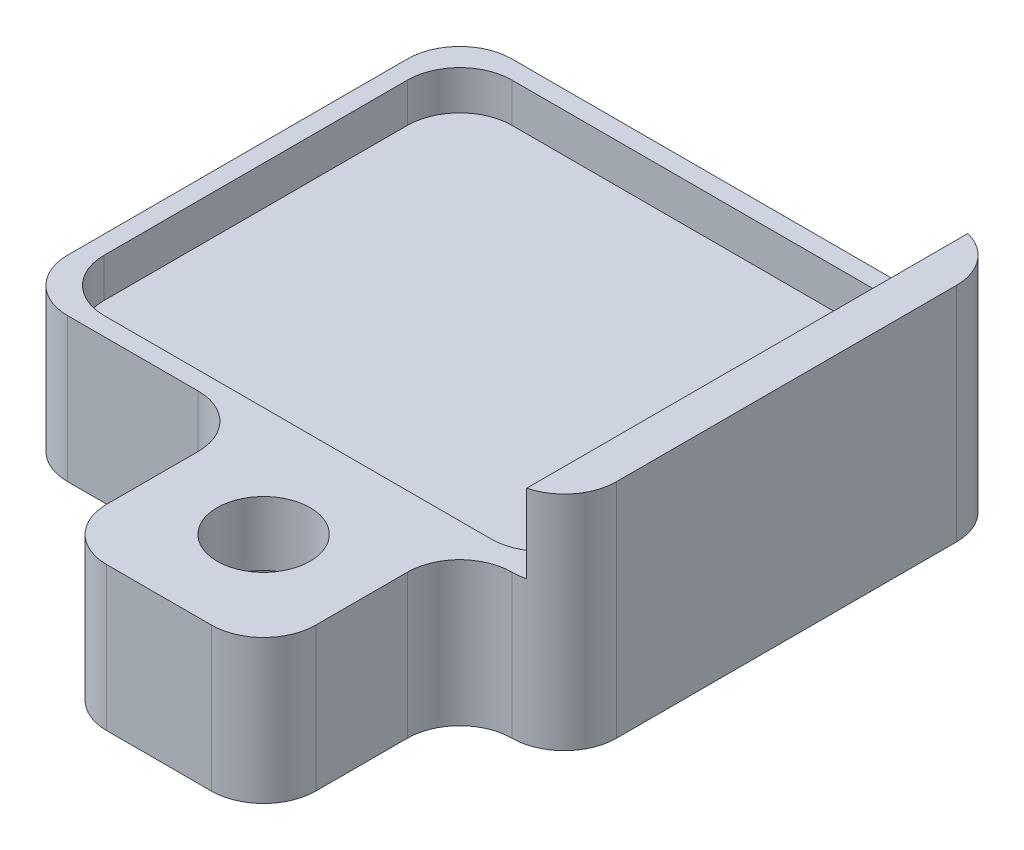
from build123d import *

# Parameters (mm, degrees)
SKETCH1_W                                      = 10.5
SKETCH1_H                                      = 8.5
EXTRUDE1_DEPTH                                 = 4.25
SKETCH3_W                                      = 9.75
SKETCH3_H                                      = 8.5
EXTRUDE4_DEPTH                                 = 1.5
SKETCH4_W                                      = 9.4
SKETCH4_H                                      = 7.8
EXTRUDE5_DEPTH                                 = 0.75
SKETCH5_W                                      = 4
SKETCH5_H                                      = 2.75
EXTRUDE6_DEPTH                                 = 3.75
CBORE_FOR_0_SOCKET_HEAD_CAP_SCREW1_D           = 1.778
CBORE_FOR_0_SOCKET_HEAD_CAP_SCREW1_CBORE_D     = 3.175
CBORE_FOR_0_SOCKET_HEAD_CAP_SCREW1_CBORE_DEPTH = 1.524
FILLET1_R                                      = 1


with BuildPart() as part:
    # Sketch1 → Extrude1 (new body)
    with BuildSketch(Plane(origin=(0, 0, 0), x_dir=(1, 0, 0), z_dir=(0, 1, 0))):
        Rectangle(SKETCH1_W, SKETCH1_H)
    extrude(amount=EXTRUDE1_DEPTH)

    # Sketch3 → Extrude4 (cut)
    with BuildSketch(Plane(origin=(0, 4.25, 0), x_dir=(1, 0, 0), z_dir=(0, 1, 0))):
        with Locations((-0.375, 0)):
            Rectangle(SKETCH3_W, SKETCH3_H)
    extrude(amount=-EXTRUDE4_DEPTH, mode=Mode.SUBTRACT)

    # Sketch4 → Extrude5 (cut)
    with BuildSketch(Plane(origin=(0, 2.75, 0), x_dir=(1, 0, 0), z_dir=(0, 1, 0))):
        with Locations((-0.2, 0)):
            Rectangle(SKETCH4_W, SKETCH4_H)
    extrude(amount=-EXTRUDE5_DEPTH, mode=Mode.SUBTRACT)

    # Sketch5 → Extrude6 (add)
    with BuildSketch(Plane.XY.offset(4.25)):
        with Locations((1.25, 1.375)):
            Rectangle(SKETCH5_W, SKETCH5_H)
    extrude(amount=EXTRUDE6_DEPTH)

    # CBORE for #0 Socket Head Cap Screw1 (through all)
    with Locations(Plane(origin=(1.25, 0, 6), x_dir=(0, 0, -1), z_dir=(0, -1, 0))):
        with Locations((0, 0)):
            CounterBoreHole(CBORE_FOR_0_SOCKET_HEAD_CAP_SCREW1_D / 2, CBORE_FOR_0_SOCKET_HEAD_CAP_SCREW1_CBORE_D / 2, CBORE_FOR_0_SOCKET_HEAD_CAP_SCREW1_CBORE_DEPTH)

    # Fillet1
    # the kernel refuses this fillet: 1 mm, written as the material it adds along each edge
    with BuildSketch(Plane(origin=(3.25, 2.75, 4.25), x_dir=(0, 0, 1), z_dir=(0, -1, 0))) as fillet1_piece_1:
        with BuildLine():
            CenterArc((FILLET1_R, -FILLET1_R), FILLET1_R, 90, 90)
            Line((0, -FILLET1_R), (0, 0))
            Line((0, 0), (FILLET1_R, 0))
        make_face()
    extrude(amount=2.75)
    with BuildSketch(Plane(origin=(-0.75, 0, 4.25), x_dir=(-1, 0, 0), z_dir=(0, 1, 0))) as fillet1_piece_2:
        with BuildLine():
            CenterArc((FILLET1_R, FILLET1_R), FILLET1_R, 180, 90)
            Line((0, FILLET1_R), (0, 0))
            Line((0, 0), (FILLET1_R, 0))
        make_face()
    extrude(amount=2.75)
    with BuildSketch(Plane(origin=(4.5, 2.75, -3.9), x_dir=(0, 0, 1), z_dir=(0, -1, 0)), Plane(origin=(-4.9, 2.75, -3.9), x_dir=(1, 0, 0), z_dir=(0, -1, 0)), Plane(origin=(-4.9, 2.75, 3.9), x_dir=(0, 0, -1), z_dir=(0, -1, 0))) as fillet1_piece_3:
        with BuildLine():
            CenterArc((FILLET1_R, FILLET1_R), FILLET1_R, 180, 90)
            Line((0, FILLET1_R), (0, 0))
            Line((0, 0), (FILLET1_R, 0))
        make_face()
    extrude(amount=0.75)
    with BuildSketch(Plane(origin=(4.5, 2.75, 3.9), x_dir=(0, 0, -1), z_dir=(0, -1, 0))) as fillet1_piece_4:
        with BuildLine():
            CenterArc((FILLET1_R, -FILLET1_R), FILLET1_R, 90, 90)
            Line((0, -FILLET1_R), (0, 0))
            Line((0, 0), (FILLET1_R, 0))
        make_face()
    extrude(amount=0.75)
    # the kernel refuses this fillet: 1 mm, written as the material it takes off along each edge
    with BuildSketch(Plane(origin=(5.25, -2.5, -4.25), x_dir=(-1, 0, 0), z_dir=(0, 1, 0)), Plane(origin=(5.25, -2.5, 4.25), x_dir=(0, 0, -1), z_dir=(0, 1, 0))) as fillet1_2_piece_1:
        with BuildLine():
            CenterArc((FILLET1_R, FILLET1_R), FILLET1_R, 180, 90)
            Line((0, FILLET1_R), (0, 0))
            Line((0, 0), (FILLET1_R, 0))
        make_face()
    extrude(amount=9.25, mode=Mode.SUBTRACT)
    with BuildSketch(Plane(origin=(3.25, 5.25, 8), x_dir=(0, 0, -1), z_dir=(0, -1, 0))) as fillet1_2_piece_2:
        with BuildLine():
            CenterArc((FILLET1_R, -FILLET1_R), FILLET1_R, 90, 90)
            Line((0, -FILLET1_R), (0, 0))
            Line((0, 0), (FILLET1_R, 0))
        make_face()
    extrude(amount=7.75, mode=Mode.SUBTRACT)
    with BuildSketch(Plane(origin=(-0.75, -2.5, 8), x_dir=(1, 0, 0), z_dir=(0, 1, 0)), Plane(origin=(-5.25, -2.5, -4.25), x_dir=(0, 0, 1), z_dir=(0, 1, 0)), Plane(origin=(-5.25, -2.5, 4.25), x_dir=(1, 0, 0), z_dir=(0, 1, 0))) as fillet1_2_piece_3:
        with BuildLine():
            CenterArc((FILLET1_R, FILLET1_R), FILLET1_R, 180, 90)
            Line((0, FILLET1_R), (0, 0))
            Line((0, 0), (FILLET1_R, 0))
        make_face()
    extrude(amount=7.75, mode=Mode.SUBTRACT)


solid = part.part
